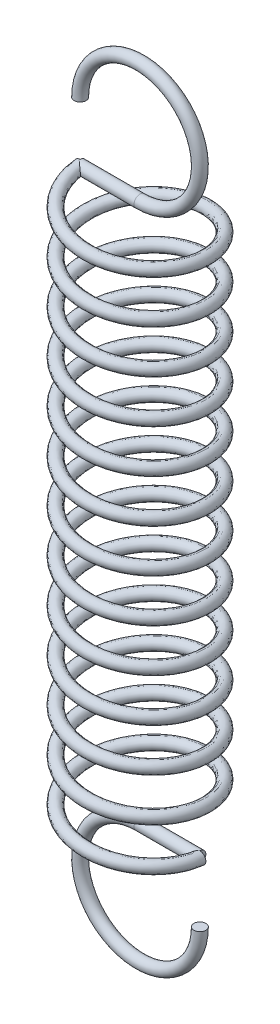
from build123d import *

# Parameters (mm, degrees)
BALAYAGE1_PITCH       = 1.8
BALAYAGE1_HEIGHT      = 22.5
BALAYAGE1_RADIUS      = 2.5
BALAYAGE1_START_ANGLE = 90
ESQUISSE2_R           = 0.25
ESQUISSE4_R           = 0.25
ESQUISSE4_4_R         = 0.25
ESQUISSE8_R           = 0.25
ESQUISSE8_2_R         = 0.25


with BuildPart() as part:
    # Balayage1: sweep along a helix
    with BuildLine() as balayage1_path:
        add(Helix(BALAYAGE1_PITCH, BALAYAGE1_HEIGHT, BALAYAGE1_RADIUS, center=(0, 0, 0), direction=(0, 1, 0), lefthand=True, mode=Mode.PRIVATE).rotate(Axis((0, 0, 0), (0, 1, 0)), BALAYAGE1_START_ANGLE))
    # Esquisse2 → Balayage1 (sweep)
    with BuildSketch(Plane.XY):
        with Locations((2.5, 0)):
            Circle(ESQUISSE2_R)
    sweep(path=balayage1_path.line, is_frenet=True)



with BuildPart() as body_2:
    # Balayage3: sweep along a path in Esquisse5
    with BuildLine(Plane.XY) as balayage3_path:
        ThreePointArc((0, 0), (-1.767766953, -4.267766953), (2.5, -2.5))
    # Esquisse4 → Balayage3 (sweep)
    with BuildSketch(Plane(origin=(0, 0, 0), x_dir=(0, 0, -1), z_dir=(1, 0, 0))):
        Circle(ESQUISSE4_R)
    sweep(path=balayage3_path.line)


with BuildPart() as part_1:
    add(part.part)

    add(body_2.part)  # Balayage6 merges body 2
    # Balayage6: sweep along a path in Esquisse6
    with BuildLine(Plane(origin=(0, 0, 0), x_dir=(1, 0, 0), z_dir=(0, 1, 0))) as balayage6_path:
        Line((0, 0), (2.5, 0))
    # Esquisse4<4> → Balayage6 (sweep)
    with BuildSketch(Plane(origin=(0, 0, 0), x_dir=(0, 0, -1), z_dir=(1, 0, 0))):
        Circle(ESQUISSE4_4_R)
    sweep(path=balayage6_path.line)



with BuildPart() as body_2_2:
    # Balayage7: sweep along a path in Esquisse7
    with BuildLine(Plane.XY) as balayage7_path:
        ThreePointArc((0, 22.5), (1.767766953, 26.767766953), (-2.5, 25))
    # Esquisse8 → Balayage7 (sweep)
    with BuildSketch(Plane(origin=(0, 0, 0), x_dir=(0, 0, -1), z_dir=(1, 0, 0))):
        with Locations((0, 22.5)):
            Circle(ESQUISSE8_R)
    sweep(path=balayage7_path.line)


with BuildPart() as part_2:
    add(part_1.part)

    add(body_2_2.part)  # Balayage8 merges body 2 2
    # Balayage8: sweep along a path in Esquisse10
    with BuildLine(Plane.XY) as balayage8_path:
        Line((0, 22.5), (-2.5, 22.5))
    # Esquisse8<2> → Balayage8 (sweep)
    with BuildSketch(Plane(origin=(0, 0, 0), x_dir=(0, 0, -1), z_dir=(1, 0, 0))):
        with Locations((0, 22.5)):
            Circle(ESQUISSE8_2_R)
    sweep(path=balayage8_path.line)


solid = part_2.part
